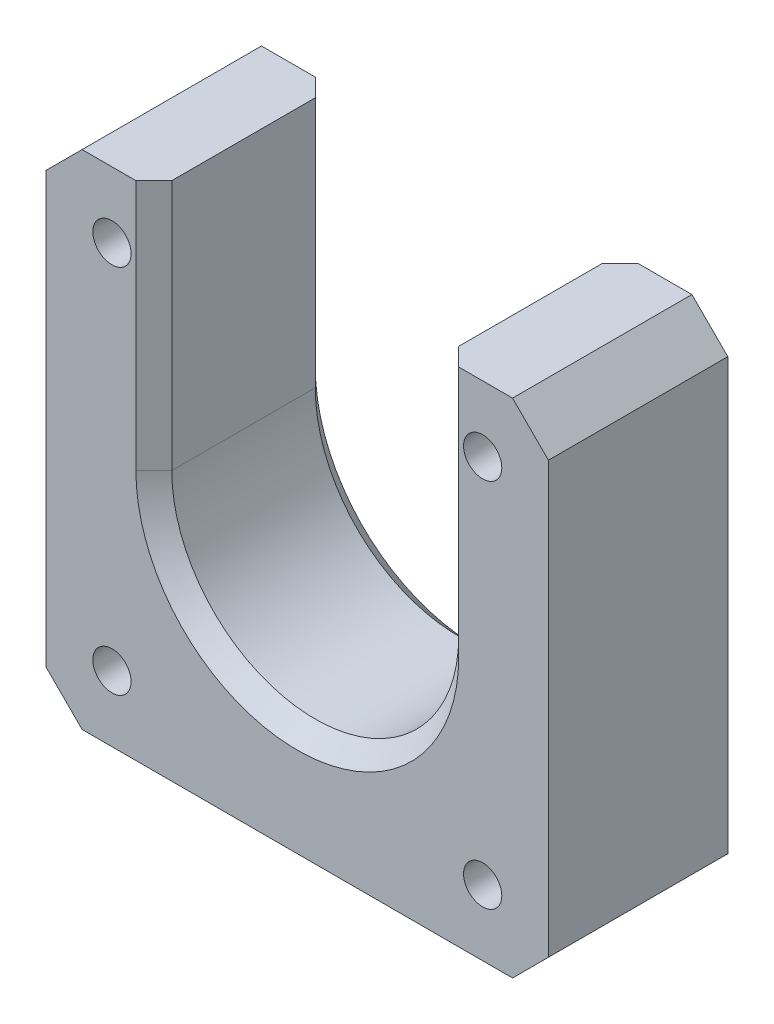
from build123d import *

# Parameters (mm, degrees)
SKETCH1_W           = 42
SKETCH1_H           = 42
BOSS_EXTRUDE1_DEPTH = 15
SKETCH2_R           = 1.6
CUT_EXTRUDE1_DEPTH  = 30
CHAMFER1_SIZE       = 3
CHAMFER2_SIZE       = 3
CHAMFER3_SIZE       = 3
CHAMFER4_SIZE       = 3
CHAMFER6_SIZE       = 1.5


with BuildPart() as part:
    # Sketch1 → Boss-Extrude1 (new body)
    with BuildSketch(Plane.XY):
        Rectangle(SKETCH1_W, SKETCH1_H)
    extrude(amount=BOSS_EXTRUDE1_DEPTH)

    # Sketch2 → Cut-Extrude1 (cut)
    with BuildSketch(Plane.XY.offset(15)):
        with Locations((-15.5, 15.5)):
            Circle(SKETCH2_R)
        with Locations((15.5, -15.5)):
            Circle(SKETCH2_R)
        with Locations((15.5, 15.5)):
            Circle(SKETCH2_R)
        with Locations((-15.5, -15.5)):
            Circle(SKETCH2_R)
        with BuildLine():
            Line((-12, 0), (-12, 21))
            Line((-12, 21), (12, 21))
            Line((12, 21), (12, 0))
            ThreePointArc((12, 0), (0, -12), (-12, 0))
        make_face()
    extrude(amount=-CUT_EXTRUDE1_DEPTH, mode=Mode.SUBTRACT)

    # Chamfer1
    chamfer1_edges = [part.edges().sort_by_distance(p)[0] for p in [
        (-21, 21, 7.5),
    ]]
    chamfer(chamfer1_edges, length=CHAMFER1_SIZE)

    # Chamfer2
    chamfer2_edges = [part.edges().sort_by_distance(p)[0] for p in [
        (21, 21, 7.5),
    ]]
    chamfer(chamfer2_edges, length=CHAMFER2_SIZE)

    # Chamfer3
    chamfer3_edges = [part.edges().sort_by_distance(p)[0] for p in [
        (21, -21, 7.5),
    ]]
    chamfer(chamfer3_edges, length=CHAMFER3_SIZE)

    # Chamfer4
    chamfer4_edges = [part.edges().sort_by_distance(p)[0] for p in [
        (-21, -21, 7.5),
    ]]
    chamfer(chamfer4_edges, length=CHAMFER4_SIZE)

    # Chamfer6
    chamfer6_edges = [part.edges().sort_by_distance(p)[0] for p in [
        (-12, 10.5, 0),
        (12, 10.5, 0),
        (0, -12, 0),
        (-12, 10.5, 15),
        (12, 10.5, 15),
        (0, -12, 15),
    ]]
    chamfer(chamfer6_edges, length=CHAMFER6_SIZE)


solid = part.part
